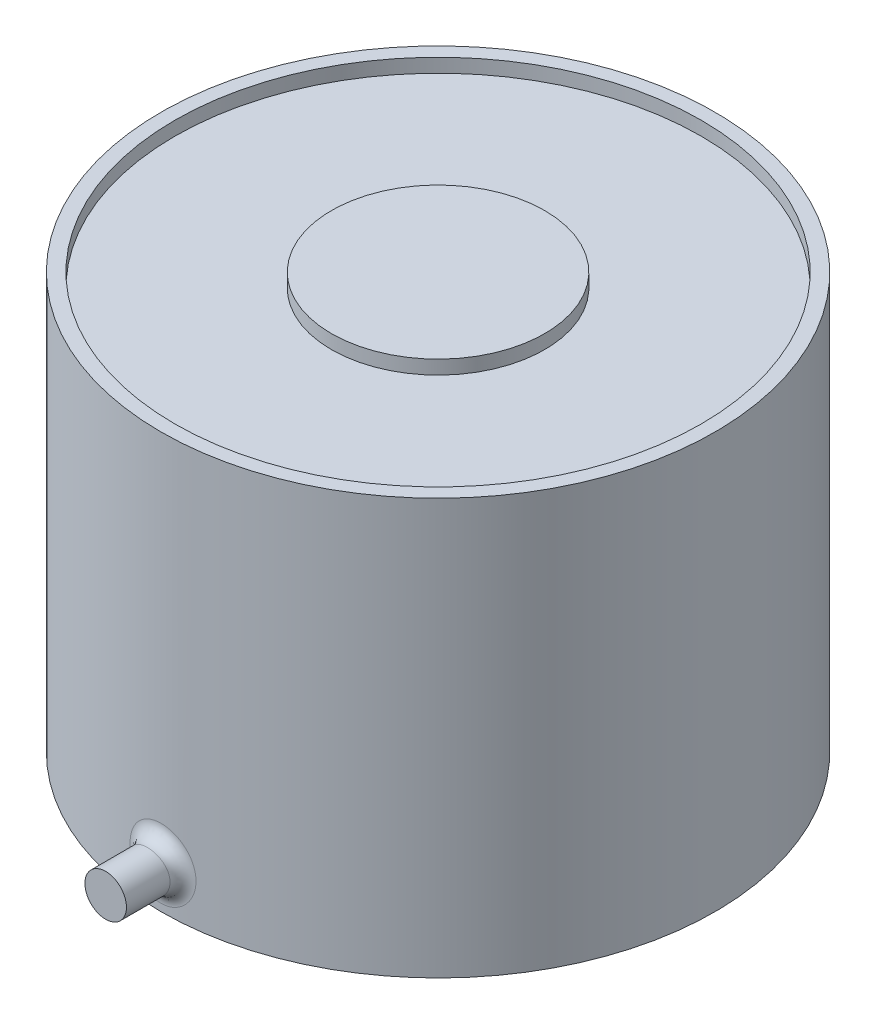
from build123d import *

# Parameters (mm, degrees)
ESQUISSE1_R             = 10
BOSS_EXTRU_1_DEPTH      = 15
ESQUISSE2_R             = 9.5
ESQUISSE2_R_2           = 3.85
ENL_V_MAT_EXTRU_1_DEPTH = 0.5
ESQUISSE3_R             = 0.75
BOSS_EXTRU_2_DEPTH      = 3
CONG_1_R                = 0.5


with BuildPart() as part:
    # Esquisse1 → Boss.-Extru.1 (new body)
    with BuildSketch(Plane(origin=(0, 0, 0), x_dir=(1, 0, 0), z_dir=(0, 1, 0))):
        Circle(ESQUISSE1_R)
    extrude(amount=BOSS_EXTRU_1_DEPTH)

    # Esquisse2 → Enlèv. mat.-Extru.1 (cut)
    with BuildSketch(Plane(origin=(0, 15, 0), x_dir=(1, 0, 0), z_dir=(0, 1, 0))):
        Circle(ESQUISSE2_R)
        Circle(ESQUISSE2_R_2, mode=Mode.SUBTRACT)
    extrude(amount=-ENL_V_MAT_EXTRU_1_DEPTH, mode=Mode.SUBTRACT)

    # Esquisse3 → Boss.-Extru.2 (add)
    with BuildSketch(Plane.XY.offset(9)):
        with Locations((0, 1.513817118)):
            Circle(ESQUISSE3_R)
    extrude(amount=BOSS_EXTRU_2_DEPTH)

    # Congé1
    cong_1_edges = [part.edges().sort_by_distance(p)[0] for p in [
        (-0.75, 1.513817118, 9.971835338),
    ]]
    fillet(cong_1_edges, radius=CONG_1_R)


solid = part.part
